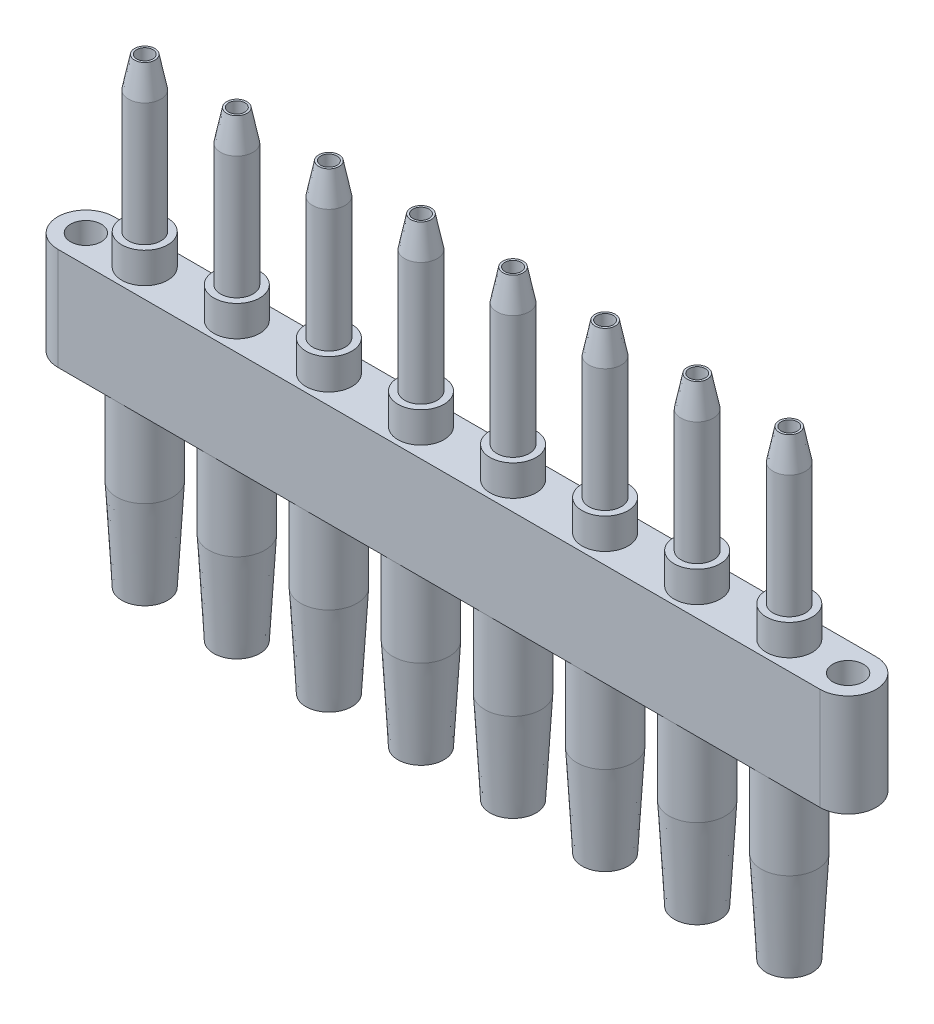
from build123d import *

# Parameters (mm, degrees)
SKETCH1_R             = 2.75
SKETCH1_R_2           = 0.79375
BOSS_EXTRUDE1_DEPTH   = 8.1
BOSS_EXTRUDE1_2_DEPTH = 8.1
BOSS_EXTRUDE1_3_DEPTH = 8.1
BOSS_EXTRUDE1_4_DEPTH = 8.1
BOSS_EXTRUDE1_5_DEPTH = 8.1
BOSS_EXTRUDE1_6_DEPTH = 8.1
BOSS_EXTRUDE1_7_DEPTH = 8.1
BOSS_EXTRUDE1_8_DEPTH = 8.1
LPATTERN4_COUNT       = 8
LPATTERN4_PITCH       = 9
BOSS_EXTRUDE2_START   = 10
SKETCH10_R            = 0.79375
SKETCH10_R_2          = 1.5
BOSS_EXTRUDE2_DEPTH   = 10
SKETCH11_R            = 1.5875
SKETCH11_R_2          = 0.79375
BOSS_EXTRUDE3_DEPTH   = 15
BOSS_EXTRUDE3_2_DEPTH = 15
BOSS_EXTRUDE3_3_DEPTH = 15
BOSS_EXTRUDE3_4_DEPTH = 15
BOSS_EXTRUDE3_5_DEPTH = 15
BOSS_EXTRUDE3_6_DEPTH = 15
BOSS_EXTRUDE3_7_DEPTH = 15
BOSS_EXTRUDE3_8_DEPTH = 15
LPATTERN6_COUNT       = 8
LPATTERN6_PITCH       = 9
BOSS_EXTRUDE5_START   = 10
SKETCH10_2_R          = 0.79375
SKETCH10_2_R_2        = 1.5
BOSS_EXTRUDE5_DEPTH   = 10
SKETCH20_R            = 2.25
SKETCH20_R_2          = 0.79375
BOSS_EXTRUDE6_DEPTH   = 3


with BuildPart() as part:
    # Sketch1 → Boss-Extrude1 (new body)
    with BuildSketch(Plane(origin=(0, 0, 0), x_dir=(1, 0, 0), z_dir=(0, 1, 0))):
        with Locations((-4.5, 0)):
            Circle(SKETCH1_R)
        with Locations((-4.5, 0)):
            Circle(SKETCH1_R_2, mode=Mode.SUBTRACT)
    extrude(amount=-BOSS_EXTRUDE1_DEPTH)



with BuildPart() as body_2:
    # Sketch1 → Boss-Extrude1 2 (new body)
    with BuildSketch(Plane(origin=(0, 0, 0), x_dir=(1, 0, 0), z_dir=(0, 1, 0))):
        with Locations((4.5, 0)):
            Circle(SKETCH1_R)
        with Locations((4.5, 0)):
            Circle(SKETCH1_R_2, mode=Mode.SUBTRACT)
    extrude(amount=-BOSS_EXTRUDE1_2_DEPTH)


with BuildPart() as body_3:
    # Sketch1 → Boss-Extrude1 3 (new body)
    with BuildSketch(Plane(origin=(0, 0, 0), x_dir=(1, 0, 0), z_dir=(0, 1, 0))):
        with Locations((13.5, 0)):
            Circle(SKETCH1_R)
        with Locations((13.5, 0)):
            Circle(SKETCH1_R_2, mode=Mode.SUBTRACT)
    extrude(amount=-BOSS_EXTRUDE1_3_DEPTH)


with BuildPart() as body_4:
    # Sketch1 → Boss-Extrude1 4 (new body)
    with BuildSketch(Plane(origin=(0, 0, 0), x_dir=(1, 0, 0), z_dir=(0, 1, 0))):
        with Locations((22.5, 0)):
            Circle(SKETCH1_R)
        with Locations((22.5, 0)):
            Circle(SKETCH1_R_2, mode=Mode.SUBTRACT)
    extrude(amount=-BOSS_EXTRUDE1_4_DEPTH)


with BuildPart() as body_5:
    # Sketch1 → Boss-Extrude1 5 (new body)
    with BuildSketch(Plane(origin=(0, 0, 0), x_dir=(1, 0, 0), z_dir=(0, 1, 0))):
        with Locations((31.5, 0)):
            Circle(SKETCH1_R)
        with Locations((31.5, 0)):
            Circle(SKETCH1_R_2, mode=Mode.SUBTRACT)
    extrude(amount=-BOSS_EXTRUDE1_5_DEPTH)


with BuildPart() as body_6:
    # Sketch1 → Boss-Extrude1 6 (new body)
    with BuildSketch(Plane(origin=(0, 0, 0), x_dir=(1, 0, 0), z_dir=(0, 1, 0))):
        with Locations((-13.5, 0)):
            Circle(SKETCH1_R)
        with Locations((-13.5, 0)):
            Circle(SKETCH1_R_2, mode=Mode.SUBTRACT)
    extrude(amount=-BOSS_EXTRUDE1_6_DEPTH)


with BuildPart() as body_7:
    # Sketch1 → Boss-Extrude1 7 (new body)
    with BuildSketch(Plane(origin=(0, 0, 0), x_dir=(1, 0, 0), z_dir=(0, 1, 0))):
        with Locations((-22.5, 0)):
            Circle(SKETCH1_R)
        with Locations((-22.5, 0)):
            Circle(SKETCH1_R_2, mode=Mode.SUBTRACT)
    extrude(amount=-BOSS_EXTRUDE1_7_DEPTH)


with BuildPart() as body_8:
    # Sketch1 → Boss-Extrude1 8 (new body)
    with BuildSketch(Plane(origin=(0, 0, 0), x_dir=(1, 0, 0), z_dir=(0, 1, 0))):
        with Locations((-31.5, 0)):
            Circle(SKETCH1_R)
        with Locations((-31.5, 0)):
            Circle(SKETCH1_R_2, mode=Mode.SUBTRACT)
    extrude(amount=-BOSS_EXTRUDE1_8_DEPTH)


with BuildPart() as body_9:
    # Sketch9 → Revolve1 (revolve)
    with BuildSketch(Plane(origin=(-31.5, 0, 0), x_dir=(0, 0, -1), z_dir=(1, 0, 0))):
        Polygon((-0.79375, -8.1), (-0.79375, -17.1), (-2.25, -17.1), (-2.75, -8.1), align=None)
    revolve(axis=Axis((-31.5, -15.252901708, 0), (0, -1, 0)))


with BuildPart() as lpattern4_1:
    # LPattern4: pattern copy
    add(body_9.part.moved(Location(Vector(1, 0, 0) * (1 * LPATTERN4_PITCH))))


with BuildPart() as lpattern4_2:
    # LPattern4: pattern copy
    add(body_9.part.moved(Location(Vector(1, 0, 0) * (2 * LPATTERN4_PITCH))))


with BuildPart() as lpattern4_3:
    # LPattern4: pattern copy
    add(body_9.part.moved(Location(Vector(1, 0, 0) * (3 * LPATTERN4_PITCH))))


with BuildPart() as lpattern4_4:
    # LPattern4: pattern copy
    add(body_9.part.moved(Location(Vector(1, 0, 0) * (4 * LPATTERN4_PITCH))))


with BuildPart() as lpattern4_5:
    # LPattern4: pattern copy
    add(body_9.part.moved(Location(Vector(1, 0, 0) * (5 * LPATTERN4_PITCH))))


with BuildPart() as lpattern4_6:
    # LPattern4: pattern copy
    add(body_9.part.moved(Location(Vector(1, 0, 0) * (6 * LPATTERN4_PITCH))))


with BuildPart() as lpattern4_7:
    # LPattern4: pattern copy
    add(body_9.part.moved(Location(Vector(1, 0, 0) * (7 * LPATTERN4_PITCH))))


with BuildPart() as part_1:
    add(part.part)

    add(body_2.part)  # Boss-Extrude2 merges body 2

    add(body_3.part)  # Boss-Extrude2 merges body 3

    add(body_4.part)  # Boss-Extrude2 merges body 4

    add(body_5.part)  # Boss-Extrude2 merges body 5

    add(body_6.part)  # Boss-Extrude2 merges body 6

    add(body_7.part)  # Boss-Extrude2 merges body 7

    add(body_8.part)  # Boss-Extrude2 merges body 8
    # Sketch10 → Boss-Extrude2 (add)
    with BuildSketch(Plane(origin=(0, 0, 0), x_dir=(1, 0, 0), z_dir=(0, 1, 0)).offset(BOSS_EXTRUDE2_START)):
        with BuildLine():
            Line((37.25, -2.75), (-37.25, -2.75))
            ThreePointArc((-37.25, -2.75), (-40, 0), (-37.25, 2.75))
            Line((-37.25, 2.75), (37.25, 2.75))
            ThreePointArc((37.25, 2.75), (40, 0), (37.25, -2.75))
        make_face()
        with Locations((-31.5, 0)):
            Circle(SKETCH10_R, mode=Mode.SUBTRACT)
        with Locations((-22.5, 0)):
            Circle(SKETCH10_R, mode=Mode.SUBTRACT)
        with Locations((-37.25, 0)):
            Circle(SKETCH10_R_2, mode=Mode.SUBTRACT)
        with Locations((37.25, 0)):
            Circle(SKETCH10_R_2, mode=Mode.SUBTRACT)
        with Locations((-13.5, 0)):
            Circle(SKETCH10_R, mode=Mode.SUBTRACT)
        with Locations((-4.5, 0)):
            Circle(SKETCH10_R, mode=Mode.SUBTRACT)
        with Locations((4.5, 0)):
            Circle(SKETCH10_R, mode=Mode.SUBTRACT)
        with Locations((13.5, 0)):
            Circle(SKETCH10_R, mode=Mode.SUBTRACT)
        with Locations((22.5, 0)):
            Circle(SKETCH10_R, mode=Mode.SUBTRACT)
        with Locations((31.5, 0)):
            Circle(SKETCH10_R, mode=Mode.SUBTRACT)
    extrude(amount=-BOSS_EXTRUDE2_DEPTH)



with BuildPart() as body_10:
    # Sketch11 → Boss-Extrude3 (new body)
    with BuildSketch(Plane(origin=(0, 10, 0), x_dir=(1, 0, 0), z_dir=(0, 1, 0))):
        with Locations((-31.5, 0)):
            Circle(SKETCH11_R)
        with Locations((-31.5, 0)):
            Circle(SKETCH11_R_2, mode=Mode.SUBTRACT)
    extrude(amount=BOSS_EXTRUDE3_DEPTH)

    # Sketch18 → Revolve3 (revolve)
    with BuildSketch(Plane.XY):
        Polygon((-32.4921875, 28), (-32.29375, 28), (-32.29375, 25), (-33.0875, 25), align=None)
    revolve3 = revolve(axis=Axis((-31.5, 25, 0), (0, -1, 0)))


with BuildPart() as body_11:
    # Sketch11 → Boss-Extrude3 2 (new body)
    with BuildSketch(Plane(origin=(0, 10, 0), x_dir=(1, 0, 0), z_dir=(0, 1, 0))):
        with Locations((-22.5, 0)):
            Circle(SKETCH11_R)
        with Locations((-22.5, 0)):
            Circle(SKETCH11_R_2, mode=Mode.SUBTRACT)
    extrude(amount=BOSS_EXTRUDE3_2_DEPTH)



with BuildPart() as body_12:
    # Sketch11 → Boss-Extrude3 3 (new body)
    with BuildSketch(Plane(origin=(0, 10, 0), x_dir=(1, 0, 0), z_dir=(0, 1, 0))):
        with Locations((-13.5, 0)):
            Circle(SKETCH11_R)
        with Locations((-13.5, 0)):
            Circle(SKETCH11_R_2, mode=Mode.SUBTRACT)
    extrude(amount=BOSS_EXTRUDE3_3_DEPTH)


with BuildPart() as body_13:
    # Sketch11 → Boss-Extrude3 4 (new body)
    with BuildSketch(Plane(origin=(0, 10, 0), x_dir=(1, 0, 0), z_dir=(0, 1, 0))):
        with Locations((-4.5, 0)):
            Circle(SKETCH11_R)
        with Locations((-4.5, 0)):
            Circle(SKETCH11_R_2, mode=Mode.SUBTRACT)
    extrude(amount=BOSS_EXTRUDE3_4_DEPTH)


with BuildPart() as body_14:
    # Sketch11 → Boss-Extrude3 5 (new body)
    with BuildSketch(Plane(origin=(0, 10, 0), x_dir=(1, 0, 0), z_dir=(0, 1, 0))):
        with Locations((4.5, 0)):
            Circle(SKETCH11_R)
        with Locations((4.5, 0)):
            Circle(SKETCH11_R_2, mode=Mode.SUBTRACT)
    extrude(amount=BOSS_EXTRUDE3_5_DEPTH)


with BuildPart() as body_15:
    # Sketch11 → Boss-Extrude3 6 (new body)
    with BuildSketch(Plane(origin=(0, 10, 0), x_dir=(1, 0, 0), z_dir=(0, 1, 0))):
        with Locations((13.5, 0)):
            Circle(SKETCH11_R)
        with Locations((13.5, 0)):
            Circle(SKETCH11_R_2, mode=Mode.SUBTRACT)
    extrude(amount=BOSS_EXTRUDE3_6_DEPTH)


with BuildPart() as body_16:
    # Sketch11 → Boss-Extrude3 7 (new body)
    with BuildSketch(Plane(origin=(0, 10, 0), x_dir=(1, 0, 0), z_dir=(0, 1, 0))):
        with Locations((22.5, 0)):
            Circle(SKETCH11_R)
        with Locations((22.5, 0)):
            Circle(SKETCH11_R_2, mode=Mode.SUBTRACT)
    extrude(amount=BOSS_EXTRUDE3_7_DEPTH)


with BuildPart() as body_17:
    # Sketch11 → Boss-Extrude3 8 (new body)
    with BuildSketch(Plane(origin=(0, 10, 0), x_dir=(1, 0, 0), z_dir=(0, 1, 0))):
        with Locations((31.5, 0)):
            Circle(SKETCH11_R)
        with Locations((31.5, 0)):
            Circle(SKETCH11_R_2, mode=Mode.SUBTRACT)
    extrude(amount=BOSS_EXTRUDE3_8_DEPTH)


with BuildPart() as body_11_1:
    add(body_11.part)

    add(body_12.part)  # LPattern6 merges body 12

    add(body_13.part)  # LPattern6 merges body 13

    add(body_14.part)  # LPattern6 merges body 14

    add(body_15.part)  # LPattern6 merges body 15

    add(body_16.part)  # LPattern6 merges body 16

    add(body_17.part)  # LPattern6 merges body 17
    # LPattern6: Revolve3 ×8
    with Locations(*[(i * LPATTERN6_PITCH, 0, 0) for i in range(1, LPATTERN6_COUNT)]):
        add(revolve3)


with BuildPart() as part_2:
    add(part_1.part)

    add(body_10.part)  # Boss-Extrude5 merges body 10

    add(body_11_1.part)  # Boss-Extrude5 merges body 11
    # Sketch10<2> → Boss-Extrude5 (add)
    with BuildSketch(Plane(origin=(0, 0, 0), x_dir=(1, 0, 0), z_dir=(0, 1, 0)).offset(BOSS_EXTRUDE5_START)):
        with BuildLine():
            Line((-37.25, -2.75), (37.25, -2.75))
            ThreePointArc((37.25, -2.75), (40, 0), (37.25, 2.75))
            Line((37.25, 2.75), (-37.25, 2.75))
            ThreePointArc((-37.25, 2.75), (-40, 0), (-37.25, -2.75))
        make_face()
        with Locations((-31.5, 0)):
            Circle(SKETCH10_2_R, mode=Mode.SUBTRACT)
        with Locations((-22.5, 0)):
            Circle(SKETCH10_2_R, mode=Mode.SUBTRACT)
        with Locations((-13.5, 0)):
            Circle(SKETCH10_2_R, mode=Mode.SUBTRACT)
        with Locations((-4.5, 0)):
            Circle(SKETCH10_2_R, mode=Mode.SUBTRACT)
        with Locations((4.5, 0)):
            Circle(SKETCH10_2_R, mode=Mode.SUBTRACT)
        with Locations((13.5, 0)):
            Circle(SKETCH10_2_R, mode=Mode.SUBTRACT)
        with Locations((22.5, 0)):
            Circle(SKETCH10_2_R, mode=Mode.SUBTRACT)
        with Locations((31.5, 0)):
            Circle(SKETCH10_2_R, mode=Mode.SUBTRACT)
        with Locations((-37.25, 0)):
            Circle(SKETCH10_2_R_2, mode=Mode.SUBTRACT)
        with Locations((37.25, 0)):
            Circle(SKETCH10_2_R_2, mode=Mode.SUBTRACT)
    extrude(amount=-BOSS_EXTRUDE5_DEPTH)

    # Sketch20 → Boss-Extrude6 (add)
    # profile 1 of 8: a face of its own
    with BuildSketch(Plane(origin=(0, 10, 0), x_dir=(-1, 0, 0), z_dir=(0, 1, 0))):
        with Locations((-31.5, 0)):
            Circle(SKETCH20_R)
        with Locations((-31.5, 0)):
            Circle(SKETCH20_R_2, mode=Mode.SUBTRACT)
    # profile 2 of 8: a face of its own
    with BuildSketch(Plane(origin=(0, 10, 0), x_dir=(-1, 0, 0), z_dir=(0, 1, 0))):
        with Locations((-22.5, 0)):
            Circle(SKETCH20_R)
        with Locations((-22.5, 0)):
            Circle(SKETCH20_R_2, mode=Mode.SUBTRACT)
    # profile 3 of 8: a face of its own
    with BuildSketch(Plane(origin=(0, 10, 0), x_dir=(-1, 0, 0), z_dir=(0, 1, 0))):
        with Locations((-13.5, 0)):
            Circle(SKETCH20_R)
        with Locations((-13.5, 0)):
            Circle(SKETCH20_R_2, mode=Mode.SUBTRACT)
    # profile 4 of 8: a face of its own
    with BuildSketch(Plane(origin=(0, 10, 0), x_dir=(-1, 0, 0), z_dir=(0, 1, 0))):
        with Locations((-4.5, 0)):
            Circle(SKETCH20_R)
        with Locations((-4.5, 0)):
            Circle(SKETCH20_R_2, mode=Mode.SUBTRACT)
    # profile 5 of 8: a face of its own
    with BuildSketch(Plane(origin=(0, 10, 0), x_dir=(-1, 0, 0), z_dir=(0, 1, 0))):
        with Locations((4.5, 0)):
            Circle(SKETCH20_R)
        with Locations((4.5, 0)):
            Circle(SKETCH20_R_2, mode=Mode.SUBTRACT)
    # profile 6 of 8: a face of its own
    with BuildSketch(Plane(origin=(0, 10, 0), x_dir=(-1, 0, 0), z_dir=(0, 1, 0))):
        with Locations((13.5, 0)):
            Circle(SKETCH20_R)
        with Locations((13.5, 0)):
            Circle(SKETCH20_R_2, mode=Mode.SUBTRACT)
    # profile 7 of 8: a face of its own
    with BuildSketch(Plane(origin=(0, 10, 0), x_dir=(-1, 0, 0), z_dir=(0, 1, 0))):
        with Locations((22.5, 0)):
            Circle(SKETCH20_R)
        with Locations((22.5, 0)):
            Circle(SKETCH20_R_2, mode=Mode.SUBTRACT)
    # profile 8 of 8: a face of its own
    with BuildSketch(Plane(origin=(0, 10, 0), x_dir=(-1, 0, 0), z_dir=(0, 1, 0))):
        with Locations((31.5, 0)):
            Circle(SKETCH20_R)
        with Locations((31.5, 0)):
            Circle(SKETCH20_R_2, mode=Mode.SUBTRACT)
    extrude(amount=BOSS_EXTRUDE6_DEPTH)

    # Combine1: union body 9
    add(body_9.part)

    # Combine2: union LPattern4_1, LPattern4_2, LPattern4_3, LPattern4_4, LPattern4_5, LPattern4_6, LPattern4_7
    add(lpattern4_1.part)
    add(lpattern4_2.part)
    add(lpattern4_3.part)
    add(lpattern4_4.part)
    add(lpattern4_5.part)
    add(lpattern4_6.part)
    add(lpattern4_7.part)


solid = part_2.part
